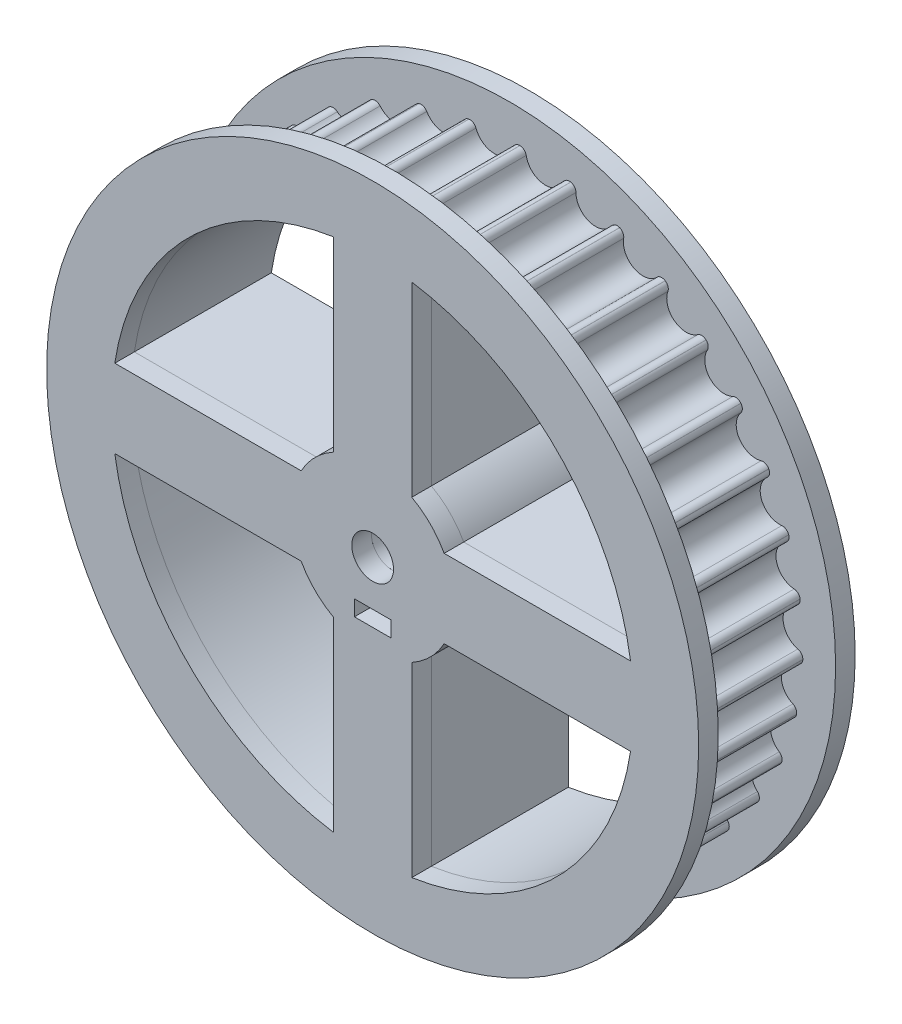
from build123d import *

# Parameters (mm, degrees)
SKETCH1_R                = 45
BOSS_EXTRUDE1_DEPTH      = 18
SKETCH3_R                = 50
BOSS_EXTRUDE2_DEPTH      = 3
SKETCH10_R               = 3
CUT_EXTRUDE7_DEPTH       = 18
FILLET1_R                = 1
CIRPATTERN1_COUNT        = 36
FILLET1_OF_CIRPATTERN1_R = 1
SKETCH4_R                = 3.2
CUT_EXTRUDE1_DEPTH       = 22
SKETCH5_W                = 6
SKETCH5_H                = 26.722630374
SKETCH5_W_2              = 26.722630374
SKETCH5_H_2              = 6
SKETCH5_W_3              = 5.6
SKETCH5_H_3              = 2.4
CUT_EXTRUDE2_DEPTH       = 25
CUT_EXTRUDE3_DEPTH       = 1
CUT_EXTRUDE3_DEPTH_BACK  = 51
SKETCH6_R                = 2
SKETCH7_R                = 50
BOSS_EXTRUDE3_DEPTH      = 3
SKETCH8_W                = 26.522630374
SKETCH8_H                = 5.8
BOSS_EXTRUDE4_DEPTH      = 3
SKETCH8_W_2              = 5.8
SKETCH8_H_2              = 26.522630374
BOSS_EXTRUDE4_2_DEPTH    = 3
BOSS_EXTRUDE4_3_DEPTH    = 3
BOSS_EXTRUDE4_4_DEPTH    = 3
CUT_EXTRUDE4_START       = -3
SKETCH9_R                = 3.2
SKETCH9_W                = 5.6
SKETCH9_H                = 2.4
CUT_EXTRUDE4_DEPTH       = 3


with BuildPart() as part:
    # Sketch1 → Boss-Extrude1 (new body)
    with BuildSketch(Plane.XY):
        Circle(SKETCH1_R)
    extrude(amount=BOSS_EXTRUDE1_DEPTH)

    # Sketch3 → Boss-Extrude2 (add)
    with BuildSketch(Plane.XY):
        Circle(SKETCH3_R)
    extrude(amount=-BOSS_EXTRUDE2_DEPTH)

    # Sketch10 → Cut-Extrude7 (cut)
    with BuildSketch(Plane.XY.offset(18)):
        with Locations((-44.661600901, 5.508303271)):
            Circle(SKETCH10_R)
    cut_extrude7 = extrude(amount=-CUT_EXTRUDE7_DEPTH, mode=Mode.SUBTRACT)

    # Fillet1
    fillet1_edges = [part.edges().sort_by_distance(p)[0] for p in [
        (-44.195336749, 8.471848064, 9),
        (-44.92936905, 2.52027713, 9),
    ]]
    fillet(fillet1_edges, radius=FILLET1_R)

    # CirPattern1: Cut-Extrude7 ×36 about axis
    cirpattern1_axis = Axis((0, 0, 18), (0, 0, -1))
    for i in range(1, CIRPATTERN1_COUNT):
        add(cut_extrude7.rotate(cirpattern1_axis, i * 360 / CIRPATTERN1_COUNT), mode=Mode.SUBTRACT)

    # Fillet1 of CirPattern1
    fillet1_of_cirpattern1_edges = [part.edges().sort_by_distance(p)[0] for p in [
        (-42.0527893, 16.017581344, 9),
        (-43.809149447, 10.283891517, 9),
        (-38.632489127, 23.07662852, 9),
        (-41.357811007, 17.735035063, 9),
        (-34.038360322, 29.434504015, 9),
        (-37.649836408, 24.647308544, 9),
        (-28.409993162, 34.898027001, 9),
        (-32.797890581, 30.810686027, 9),
        (-21.918402736, 39.301191095, 9),
        (-26.949397445, 36.037896405, 9),
        (-14.760832734, 42.510208386, 9),
        (-20.282060505, 40.170113538, 9),
        (-7.154762299, 44.427574506, 9),
        (-12.99846342, 43.081782098, 9),
        (0.668701968, 44.995031255, 9),
        (-5.319914602, 44.684432509, 9),
        (8.471848064, 44.195336749, 9),
        (2.52027713, 44.92936905, 9),
        (16.017581344, 42.0527893, 9),
        (10.283891517, 43.809149447, 9),
        (23.07662852, 38.632489127, 9),
        (17.735035063, 41.357811007, 9),
        (29.434504015, 34.038360322, 9),
        (24.647308544, 37.649836408, 9),
        (34.898027001, 28.409993162, 9),
        (30.810686027, 32.797890581, 9),
        (39.301191095, 21.918402736, 9),
        (36.037896405, 26.949397445, 9),
        (42.510208386, 14.760832734, 9),
        (40.170113538, 20.282060505, 9),
        (44.427574506, 7.154762299, 9),
        (43.081782098, 12.99846342, 9),
        (44.995031255, -0.668701968, 9),
        (44.684432509, 5.319914602, 9),
        (44.195336749, -8.471848064, 9),
        (44.92936905, -2.52027713, 9),
        (42.0527893, -16.017581344, 9),
        (43.809149447, -10.283891517, 9),
        (38.632489127, -23.07662852, 9),
        (41.357811007, -17.735035063, 9),
        (34.038360322, -29.434504015, 9),
        (37.649836408, -24.647308544, 9),
        (28.409993162, -34.898027001, 9),
        (32.797890581, -30.810686027, 9),
        (21.918402736, -39.301191095, 9),
        (26.949397445, -36.037896405, 9),
        (14.760832734, -42.510208386, 9),
        (20.282060505, -40.170113538, 9),
        (7.154762299, -44.427574506, 9),
        (12.99846342, -43.081782098, 9),
        (-0.668701968, -44.995031255, 9),
        (5.319914602, -44.684432509, 9),
        (-8.471848064, -44.195336749, 9),
        (-2.52027713, -44.92936905, 9),
        (-16.017581344, -42.0527893, 9),
        (-10.283891517, -43.809149447, 9),
        (-23.07662852, -38.632489127, 9),
        (-17.735035063, -41.357811007, 9),
        (-29.434504015, -34.038360322, 9),
        (-24.647308544, -37.649836408, 9),
        (-34.898027001, -28.409993162, 9),
        (-30.810686027, -32.797890581, 9),
        (-39.301191095, -21.918402736, 9),
        (-36.037896405, -26.949397445, 9),
        (-42.510208386, -14.760832734, 9),
        (-40.170113538, -20.282060505, 9),
        (-44.427574506, -7.154762299, 9),
        (-43.081782098, -12.99846342, 9),
        (-44.995031255, 0.668701968, 9),
        (-44.684432509, -5.319914602, 9),
    ]]
    fillet(fillet1_of_cirpattern1_edges, radius=FILLET1_OF_CIRPATTERN1_R)

    # Sketch4 → Cut-Extrude1 (cut)
    with BuildSketch(Plane.XY.offset(18)):
        Circle(SKETCH4_R)
        with BuildLine():
            Line((6, -39.547439867), (6, -10.9658561))
            ThreePointArc((6, -10.9658561), (8.838834765, -8.838834765), (10.9658561, -6))
            Line((10.9658561, -6), (39.547439867, -6))
            ThreePointArc((39.547439867, -6), (28.284271247, -28.284271247), (6, -39.547439867))
        make_face()
        with BuildLine():
            Line((-6, -39.547439867), (-6, -10.9658561))
            ThreePointArc((-6, -10.9658561), (-8.838834765, -8.838834765), (-10.9658561, -6))
            Line((-10.9658561, -6), (-39.547439867, -6))
            ThreePointArc((-39.547439867, -6), (-28.284271247, -28.284271247), (-6, -39.547439867))
        make_face()
        with BuildLine():
            Line((-39.547439867, 6), (-10.9658561, 6))
            ThreePointArc((-10.9658561, 6), (-8.838834765, 8.838834765), (-6, 10.9658561))
            Line((-6, 10.9658561), (-6, 39.547439867))
            ThreePointArc((-6, 39.547439867), (-28.284271247, 28.284271247), (-39.547439867, 6))
        make_face()
        with BuildLine():
            Line((6, 39.547439867), (6, 10.9658561))
            ThreePointArc((6, 10.9658561), (8.838834765, 8.838834765), (10.9658561, 6))
            Line((10.9658561, 6), (39.547439867, 6))
            ThreePointArc((39.547439867, 6), (28.284271247, 28.284271247), (6, 39.547439867))
        make_face()
    extrude(amount=-CUT_EXTRUDE1_DEPTH, mode=Mode.SUBTRACT)

    # Sketch5 → Cut-Extrude2 (cut)
    with BuildSketch(Plane.XY.offset(18)):
        with Locations((0, -26.247366263)):
            Rectangle(SKETCH5_W, SKETCH5_H)
        with Locations((-26.247366263, 0)):
            Rectangle(SKETCH5_W_2, SKETCH5_H_2)
        with Locations((0, 26.247366263)):
            Rectangle(SKETCH5_W, SKETCH5_H)
        with Locations((26.247366263, 0)):
            Rectangle(SKETCH5_W_2, SKETCH5_H_2)
        with Locations((0, -8.114000991)):
            Rectangle(SKETCH5_W_3, SKETCH5_H_3)
    extrude(amount=-CUT_EXTRUDE2_DEPTH, mode=Mode.SUBTRACT)

    # Sketch6 → Cut-Extrude3 (cut, two sides: drawn at the far end of the back side and taken through both)
    with BuildSketch(Plane(origin=(0, 0, 0), x_dir=(1, 0, 0), z_dir=(0, 1, 0)).offset(-CUT_EXTRUDE3_DEPTH_BACK)):
        with Locations((0, -4)):
            Circle(SKETCH6_R)
        with Locations((0, -12)):
            Circle(SKETCH6_R)
    extrude(amount=CUT_EXTRUDE3_DEPTH + CUT_EXTRUDE3_DEPTH_BACK, mode=Mode.SUBTRACT)


with BuildPart() as body_2:
    # Sketch7 → Boss-Extrude3 (new body)
    with BuildSketch(Plane.XY.offset(18)):
        Circle(SKETCH7_R)
    extrude(amount=BOSS_EXTRUDE3_DEPTH)

    # Sketch9 → Cut-Extrude4 (cut)
    with BuildSketch(Plane(origin=(0, 0, 18), x_dir=(-1, 0, 0), z_dir=(0, 0, -1)).offset(CUT_EXTRUDE4_START)):
        Circle(SKETCH9_R)
        with BuildLine():
            Line((6, -10.9658561), (6, -39.547439867))
            ThreePointArc((6, -39.547439867), (28.284271247, -28.284271247), (39.547439867, -6))
            Line((39.547439867, -6), (10.9658561, -6))
            ThreePointArc((10.9658561, -6), (8.838834765, -8.838834765), (6, -10.9658561))
        make_face()
        with BuildLine():
            Line((10.9658561, 6), (39.547439867, 6))
            ThreePointArc((39.547439867, 6), (28.284271247, 28.284271247), (6, 39.547439867))
            Line((6, 39.547439867), (6, 10.9658561))
            ThreePointArc((6, 10.9658561), (8.838834765, 8.838834765), (10.9658561, 6))
        make_face()
        with BuildLine():
            Line((-10.9658561, -6), (-39.547439867, -6))
            ThreePointArc((-39.547439867, -6), (-28.284271247, -28.284271247), (-6, -39.547439867))
            Line((-6, -39.547439867), (-6, -10.9658561))
            ThreePointArc((-6, -10.9658561), (-8.838834765, -8.838834765), (-10.9658561, -6))
        make_face()
        with BuildLine():
            Line((-6, 10.9658561), (-6, 39.547439867))
            ThreePointArc((-6, 39.547439867), (-28.284271247, 28.284271247), (-39.547439867, 6))
            Line((-39.547439867, 6), (-10.9658561, 6))
            ThreePointArc((-10.9658561, 6), (-8.838834765, 8.838834765), (-6, 10.9658561))
        make_face()
        with Locations((0, -8.114000991)):
            Rectangle(SKETCH9_W, SKETCH9_H)
    extrude(amount=CUT_EXTRUDE4_DEPTH, mode=Mode.SUBTRACT)


with BuildPart() as body_3:
    # Sketch8 → Boss-Extrude4 (new body)
    with BuildSketch(Plane(origin=(0, 0, 18), x_dir=(-1, 0, 0), z_dir=(0, 0, -1))):
        with Locations((26.247366263, 0)):
            Rectangle(SKETCH8_W, SKETCH8_H)
    extrude(amount=BOSS_EXTRUDE4_DEPTH)


with BuildPart() as body_4:
    # Sketch8 → Boss-Extrude4 2 (new body)
    with BuildSketch(Plane(origin=(0, 0, 18), x_dir=(-1, 0, 0), z_dir=(0, 0, -1))):
        with Locations((0, -26.247366263)):
            Rectangle(SKETCH8_W_2, SKETCH8_H_2)
    extrude(amount=BOSS_EXTRUDE4_2_DEPTH)


with BuildPart() as body_5:
    # Sketch8 → Boss-Extrude4 3 (new body)
    with BuildSketch(Plane(origin=(0, 0, 18), x_dir=(-1, 0, 0), z_dir=(0, 0, -1))):
        with Locations((-26.247366263, 0)):
            Rectangle(SKETCH8_W, SKETCH8_H)
    extrude(amount=BOSS_EXTRUDE4_3_DEPTH)


with BuildPart() as body_6:
    # Sketch8 → Boss-Extrude4 4 (new body)
    with BuildSketch(Plane(origin=(0, 0, 18), x_dir=(-1, 0, 0), z_dir=(0, 0, -1))):
        with Locations((0, 26.247366263)):
            Rectangle(SKETCH8_W_2, SKETCH8_H_2)
    extrude(amount=BOSS_EXTRUDE4_4_DEPTH)


with BuildPart() as body_2_1:
    add(body_2.part)

    # Combine1: union body 6, body 5, body 4, body 3
    add(body_6.part)
    add(body_5.part)
    add(body_4.part)
    add(body_3.part)


solid = Compound([part.part, body_2_1.part])
